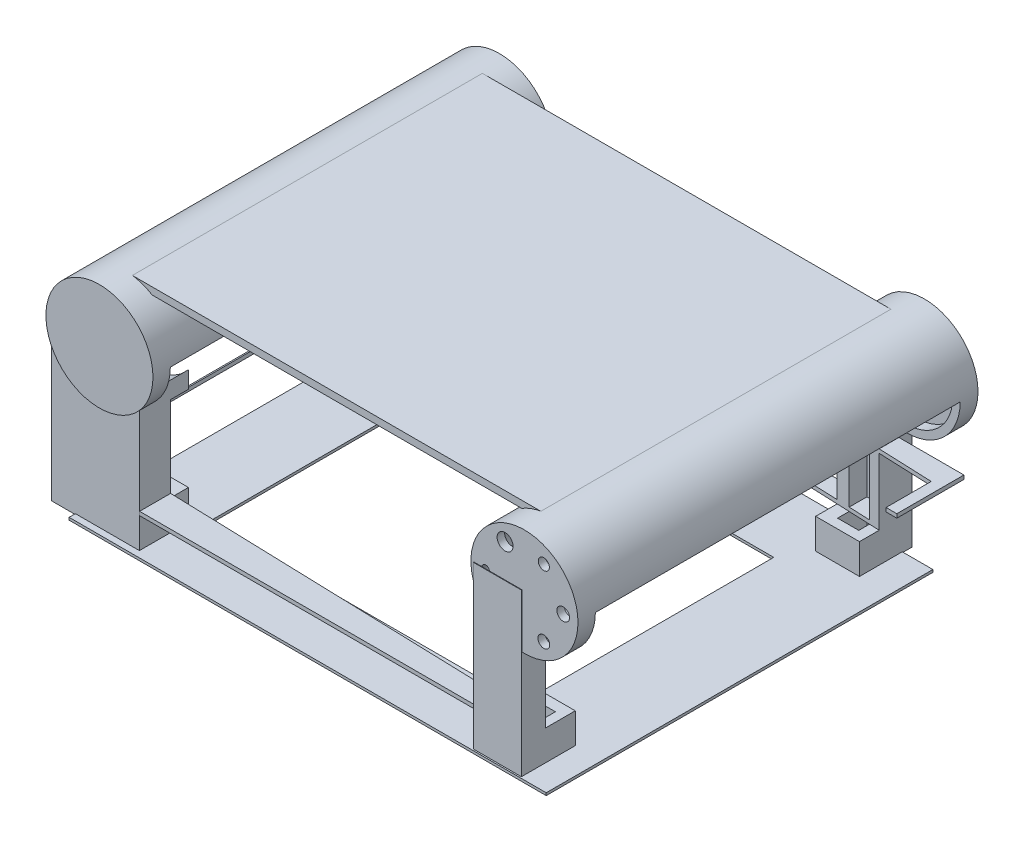
from build123d import *

# Parameters (mm, degrees)
MOTORHOLDERS_DEPTH            = 80
MOTORHOLDERS_DEPTH_BACK       = 80
MOTORHOLDERSSKETCH_R          = 21.41
MOTORHOLDERS_2_DEPTH          = 80
MOTORHOLDERS_2_DEPTH_BACK     = 80
BOSS_EXTRUDE2_DEPTH           = 70
BOSS_EXTRUDE2_DEPTH_BACK      = 70
SKETCH3_W                     = 166.402948119
SKETCH3_H                     = 2.817422897
SKETCH4_W                     = 262.774983374
SKETCH4_H                     = 145.919891702
CUT_EXTRUDE1_DEPTH            = 23
POWERBANKHOLDERS_DEPTH        = 30
POWERBANKHOLDERS_DEPTH_BACK   = 35
SKETCH6_W                     = 36.49467874
SKETCH6_H                     = 22.639087533
SKETCH6_W_2                   = 31.056806986
SKETCH6_H_2                   = 11.734008709
POWERBANKHOLDERS_2_DEPTH      = 30
POWERBANKHOLDERS_2_DEPTH_BACK = 35
SKETCH6_W_3                   = 35.167265393
SKETCH6_H_3                   = 19.610970688
SKETCH6_W_4                   = 27.697880098
SKETCH6_H_4                   = 9.83070569
POWERBANKHOLDERS_3_DEPTH      = 30
POWERBANKHOLDERS_3_DEPTH_BACK = 35
SKETCH6_W_5                   = 17.542642612
SKETCH6_H_5                   = 21.099390751
SKETCH6_W_6                   = 8.482440028
POWERBANKHOLDERS_4_DEPTH      = 30
POWERBANKHOLDERS_4_DEPTH_BACK = 35
SKETCH6_W_7                   = 19.167029737
SKETCH6_H_6                   = 21.547747601
SKETCH6_W_8                   = 10.64703133
SKETCH7_W                     = 190.824703485
SKETCH7_H                     = 154.667210728
SKETCH7_W_2                   = 125.335149465
SKETCH7_H_2                   = 100.638457321
TOPCELLPHONECOVER_DEPTH       = 1
MOTORHOLDEREXTRUDE_DEPTH      = 77
MOTORHOLDEREXTRUDE_DEPTH_BACK = 77
MOTORHOLDEREXTRUDESKETCH_R    = 18.415
CUT_EXTRUDE9_DEPTH            = 10
SKETCH13_W                    = 185.613395506
SKETCH13_H                    = 150.750513965
SKETCH13_W_2                  = 118.643379197
SKETCH13_H_2                  = 28.528180577
SKETCH13_H_3                  = 20.354411311
SKETCH13_H_4                  = 25.680107897
TOPOFPOWERBANKEXTRUDE_DEPTH   = 1.5
SKETCH15_W                    = 26.821383844
SKETCH15_H                    = 1.552281475
POWERBANKSMALLHOLDER1_DEPTH   = 26
POWERBANKEXTRUDE_DEPTH        = 34
SKETCH17_R                    = 2.532033456
SKETCH17_R_2                  = 2.360829234
SKETCH17_R_3                  = 2.843544536
SKETCH17_R_4                  = 1.512232944
SKETCH17_R_5                  = 3.192774995
SKETCH17_R_6                  = 2.221813058
CUT_EXTRUDE11_DEPTH           = 31.5


with BuildPart() as part:
    # MotorHoldersSketch → MotorHolders (new, two sides: drawn at the far end of the back side and taken through both)
    with BuildSketch(Plane.XY.offset(-MOTORHOLDERS_DEPTH_BACK)):
        Circle(MOTORHOLDERSSKETCH_R)
    extrude(amount=MOTORHOLDERS_DEPTH + MOTORHOLDERS_DEPTH_BACK)


with BuildPart() as body_2:
    # MotorHoldersSketch → MotorHolders 2 (new, two sides: drawn at the far end of the back side and taken through both)
    with BuildSketch(Plane.XY.offset(-MOTORHOLDERS_2_DEPTH_BACK)):
        with Locations((170, 0)):
            Circle(MOTORHOLDERSSKETCH_R)
    extrude(amount=MOTORHOLDERS_2_DEPTH + MOTORHOLDERS_2_DEPTH_BACK)

    # Sketch3 → Boss-Extrude2 (add, two sides: drawn at the far end of the back side and taken through both)
    with BuildSketch(Plane.XY.offset(-BOSS_EXTRUDE2_DEPTH_BACK)):
        with Locations((85.14207121, 19.724241304)):
            Rectangle(SKETCH3_W, SKETCH3_H)
    extrude(amount=BOSS_EXTRUDE2_DEPTH + BOSS_EXTRUDE2_DEPTH_BACK)


with BuildPart() as cut_extrude1_tool:
    # Sketch4 → Cut-Extrude1 (new body)
    with BuildSketch(Plane(origin=(0, 0, 0), x_dir=(1, 0, 0), z_dir=(0, 1, 0))):
        with Locations((89.893628689, -0.090874356)):
            Rectangle(SKETCH4_W, SKETCH4_H)
    extrude(amount=-CUT_EXTRUDE1_DEPTH)


with BuildPart() as part_1:
    add(part.part)

    # Cut-Extrude1: cut by cut_extrude1_tool
    add(cut_extrude1_tool.part, mode=Mode.SUBTRACT)


with BuildPart() as body_2_1:
    add(body_2.part)

    # Cut-Extrude1: cut by cut_extrude1_tool
    add(cut_extrude1_tool.part, mode=Mode.SUBTRACT)


with BuildPart() as body_3:
    # Sketch6 → PowerBankHolders (new, two sides: drawn at the far end of the back side and taken through both)
    with BuildSketch(Plane(origin=(170, -34.829272125, 0), x_dir=(-1, 0, 0), z_dir=(0, -1, 0)).offset(-POWERBANKHOLDERS_DEPTH_BACK)):
        with Locations((172.819067028, 67.629448186)):
            Rectangle(SKETCH6_W, SKETCH6_H)
        with Locations((173.298050861, 66.379140187)):
            Rectangle(SKETCH6_W_2, SKETCH6_H_2, mode=Mode.SUBTRACT)
    extrude(amount=POWERBANKHOLDERS_DEPTH + POWERBANKHOLDERS_DEPTH_BACK)



with BuildPart() as body_4:
    # Sketch6 → PowerBankHolders 2 (new, two sides: drawn at the far end of the back side and taken through both)
    with BuildSketch(Plane(origin=(170, -34.829272125, 0), x_dir=(-1, 0, 0), z_dir=(0, -1, 0)).offset(-POWERBANKHOLDERS_2_DEPTH_BACK)):
        with Locations((173.31036146, -68.476666678)):
            Rectangle(SKETCH6_W_3, SKETCH6_H_3)
        with Locations((174.225508828, -67.894738702)):
            Rectangle(SKETCH6_W_4, SKETCH6_H_4, mode=Mode.SUBTRACT)
    extrude(amount=POWERBANKHOLDERS_2_DEPTH + POWERBANKHOLDERS_2_DEPTH_BACK)


with BuildPart() as body_5:
    # Sketch6 → PowerBankHolders 3 (new, two sides: drawn at the far end of the back side and taken through both)
    with BuildSketch(Plane(origin=(170, -34.829272125, 0), x_dir=(-1, 0, 0), z_dir=(0, -1, 0)).offset(-POWERBANKHOLDERS_3_DEPTH_BACK)):
        with Locations((11.52721305, 67.312978676)):
            Rectangle(SKETCH6_W_5, SKETCH6_H_5)
        with Locations((11.033379358, 66.379140187)):
            Rectangle(SKETCH6_W_6, SKETCH6_H_2, mode=Mode.SUBTRACT)
    extrude(amount=POWERBANKHOLDERS_3_DEPTH + POWERBANKHOLDERS_3_DEPTH_BACK)


with BuildPart() as body_6:
    # Sketch6 → PowerBankHolders 4 (new, two sides: drawn at the far end of the back side and taken through both)
    with BuildSketch(Plane(origin=(170, -34.829272125, 0), x_dir=(-1, 0, 0), z_dir=(0, -1, 0)).offset(-POWERBANKHOLDERS_4_DEPTH_BACK)):
        with Locations((10.584217292, -69.445055135)):
            Rectangle(SKETCH6_W_7, SKETCH6_H_6)
        with Locations((9.951083707, -67.894738702)):
            Rectangle(SKETCH6_W_8, SKETCH6_H_4, mode=Mode.SUBTRACT)
    extrude(amount=POWERBANKHOLDERS_4_DEPTH + POWERBANKHOLDERS_4_DEPTH_BACK)


with BuildPart() as body_3_1:
    add(body_3.part)

    add(body_4.part)  # TopCellPhoneCover merges body 4

    add(body_5.part)  # TopCellPhoneCover merges body 5

    add(body_6.part)  # TopCellPhoneCover merges body 6
    # Sketch7 → TopCellPhoneCover (add)
    with BuildSketch(Plane(origin=(170, -64.5, 0), x_dir=(-1, 0, 0), z_dir=(0, -1, 0))):
        with Locations((85.907620295, -3.467393964)):
            Rectangle(SKETCH7_W, SKETCH7_H)
        with Locations((89.203645692, -4.077931617)):
            Rectangle(SKETCH7_W_2, SKETCH7_H_2, mode=Mode.SUBTRACT)
    extrude(amount=TOPCELLPHONECOVER_DEPTH)


with BuildPart() as motorholderextrude_tool:
    # MotorHolderExtrudeSketch → MotorHolderExtrude (new, two sides: drawn at the far end of the back side and taken through both)
    with BuildSketch(Plane.XY.offset(-MOTORHOLDEREXTRUDE_DEPTH_BACK)):
        with Locations((170, 0)):
            Circle(MOTORHOLDEREXTRUDESKETCH_R)
        Circle(MOTORHOLDEREXTRUDESKETCH_R)
    extrude(amount=MOTORHOLDEREXTRUDE_DEPTH + MOTORHOLDEREXTRUDE_DEPTH_BACK)


with BuildPart() as part_2:
    add(part_1.part)

    # MotorHolderExtrude: cut by motorholderextrude_tool
    add(motorholderextrude_tool.part, mode=Mode.SUBTRACT)


with BuildPart() as body_2_2:
    add(body_2_1.part)

    # MotorHolderExtrude: cut by motorholderextrude_tool
    add(motorholderextrude_tool.part, mode=Mode.SUBTRACT)


with BuildPart() as body_3_2:
    add(body_3_1.part)

    # MotorHolderExtrude: cut by motorholderextrude_tool
    add(motorholderextrude_tool.part, mode=Mode.SUBTRACT)

    # Sketch11 → Cut-Extrude9 (cut)
    with BuildSketch(Plane(origin=(0, -18.425, 0), x_dir=(1, 0, 0), z_dir=(0, 1, 0))):
        Polygon((-18.932660375, -64.758061011), (-18.932660375, 72.241938989), (188.932660375, 63.758061011), (188.932660375, -71.241938989), align=None)
    extrude(amount=-CUT_EXTRUDE9_DEPTH, mode=Mode.SUBTRACT)

    # Sketch13 → TopOfPowerBankExtrude (add)
    with BuildSketch(Plane(origin=(0, -52.425, 0), x_dir=(1, 0, 0), z_dir=(0, 1, 0))):
        with Locations((73.356932548, -2.829837215)):
            Rectangle(SKETCH13_W, SKETCH13_H)
        with Locations((78.639035232, -35.318957481)):
            Rectangle(SKETCH13_W_2, SKETCH13_H_2, mode=Mode.SUBTRACT)
        with Locations((78.639035232, 46.500602577)):
            Rectangle(SKETCH13_W_2, SKETCH13_H_3, mode=Mode.SUBTRACT)
        with Locations((78.639035232, 5.478585624)):
            Rectangle(SKETCH13_W_2, SKETCH13_H_4, mode=Mode.SUBTRACT)
    extrude(amount=TOPOFPOWERBANKEXTRUDE_DEPTH)

    # Sketch15 → PowerBankSmallHolder1 (add)
    with BuildSketch(Plane(origin=(167.244108256, 0, 0), x_dir=(0, 0, -1), z_dir=(1, 0, 0))):
        with Locations((59.120582699, -25.000313322)):
            Rectangle(SKETCH15_W, SKETCH15_H)
    extrude(amount=POWERBANKSMALLHOLDER1_DEPTH)

    # Sketch11<2> → PowerBankExtrude (cut)
    with BuildSketch(Plane(origin=(0, -18.425, 0), x_dir=(1, 0, 0), z_dir=(0, 1, 0))):
        Polygon((-18.932660375, -64.758061011), (-18.932660375, 72.241938989), (188.932660375, 63.758061011), (188.932660375, -71.241938989), align=None)
    extrude(amount=-POWERBANKEXTRUDE_DEPTH, mode=Mode.SUBTRACT)


with BuildPart() as cut_extrude11_tool:
    # Sketch17 → Cut-Extrude11 (new body)
    with BuildSketch(Plane.XY.offset(80)):
        with Locations((185.5, 0)):
            Circle(SKETCH17_R)
        with Locations((177.75, -13.42)):
            Circle(SKETCH17_R_2)
        with Locations((162.25, -13.42)):
            Circle(SKETCH17_R_3)
        with Locations((154.5, 0)):
            Circle(SKETCH17_R_4)
        with Locations((162.25, 13.42)):
            Circle(SKETCH17_R_5)
        with Locations((177.75, 13.42)):
            Circle(SKETCH17_R_6)
    extrude(amount=-CUT_EXTRUDE11_DEPTH)


with BuildPart() as body_2_3:
    add(body_2_2.part)

    # Cut-Extrude11: cut by cut_extrude11_tool
    add(cut_extrude11_tool.part, mode=Mode.SUBTRACT)


with BuildPart() as body_3_3:
    add(body_3_2.part)

    # Cut-Extrude11: cut by cut_extrude11_tool
    add(cut_extrude11_tool.part, mode=Mode.SUBTRACT)


solid = Compound([part_2.part, body_2_3.part, body_3_3.part])
